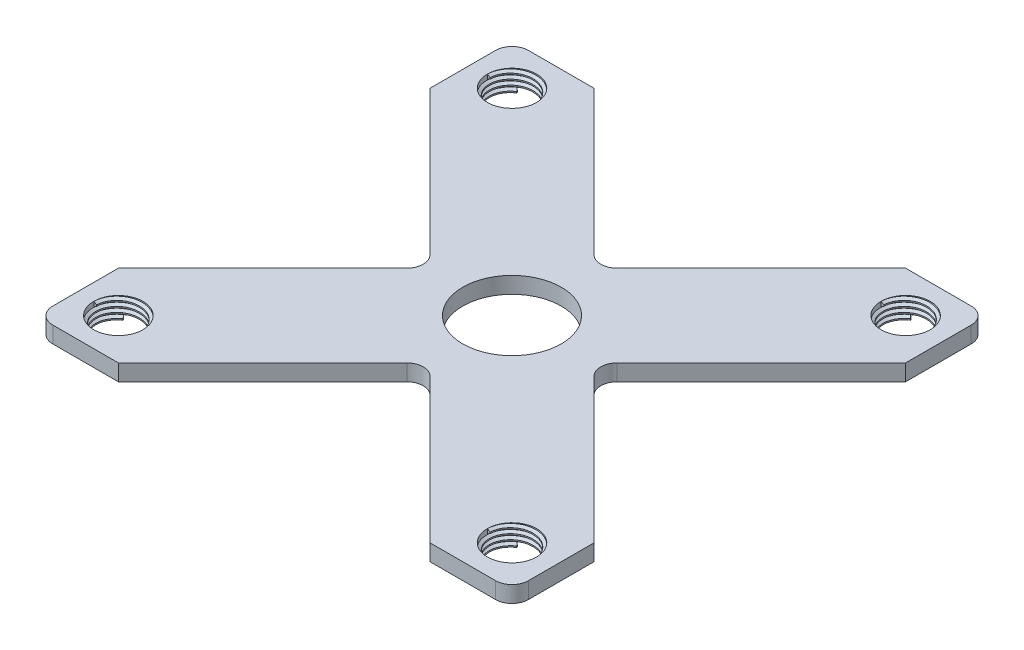
from build123d import *
from build123d.topology import SkipClean

# Parameters (mm, degrees)
SKETCH1_R           = 3
BOSS_EXTRUDE1_DEPTH = 1
FILLET1_R           = 1
SKETCH2_R           = 1.5
CUT_EXTRUDE1_DEPTH  = 10
THREAD1_PITCH       = 0.3175
THREAD2_PITCH       = 0.3175
THREAD3_PITCH       = 0.3175
THREAD4_PITCH       = 0.3175


with BuildPart() as part:
    # Sketch1 → Boss-Extrude1 (new body)
    with BuildSketch(Plane(origin=(0, 0, 0), x_dir=(1, 0, 0), z_dir=(0, 1, 0))):
        Polygon((0, 0), (9.5, 9.5), (19, 0), (24, 0), (24, 5), (14.5, 14.5), (24, 24), (24, 29), (19, 29), (9.5, 19.5), (0, 29), (-5, 29), (-5, 24), (4.5, 14.5), (-5, 5), (-5, 0), align=None)
        with Locations(Location((9.5, 14.5, 0), (0, 0, 270))):
            Circle(SKETCH1_R, mode=Mode.SUBTRACT)
    extrude(amount=BOSS_EXTRUDE1_DEPTH)

    # Fillet1
    fillet1_edges = [part.edges().sort_by_distance(p)[0] for p in [
        (-5, 0.5, 0),
        (4.5, 0.5, -14.5),
        (-5, 0.5, -29),
        (9.5, 0.5, -19.5),
        (24, 0.5, -29),
        (14.5, 0.5, -14.5),
        (24, 0.5, 0),
        (9.5, 0.5, -9.5),
    ]]
    fillet(fillet1_edges, radius=FILLET1_R)

    # Sketch2 → Cut-Extrude1 (cut)
    with BuildSketch(Plane(origin=(0, 1, 0), x_dir=(1, 0, 0), z_dir=(0, 1, 0))):
        with Locations(Location((21.5, 26.5, 0), (0, 0, 270))):
            Circle(SKETCH2_R)
        with Locations(Location((-2.5, 26.5, 0), (0, 0, 270))):
            Circle(SKETCH2_R)
        with Locations(Location((-2.5, 2.5, 0), (0, 0, 270))):
            Circle(SKETCH2_R)
        with Locations(Location((21.5, 2.5, 0), (0, 0, 270))):
            Circle(SKETCH2_R)
    extrude(amount=-CUT_EXTRUDE1_DEPTH, mode=Mode.SUBTRACT)

    # Thread1: the profile of Thread Profile1 profile screwed along a right-hand helix of 3.149606 turns, 6 arcs to a turn; built about Z, then put on its axis
    with SkipClean():  # the faces are left unmerged after this step: merging them gives an invalid solid
        thread1_z = Axis((0, 0, 0), (0, 0, 1))
        thread1_corners = [(1.5003, 0, -0.000173205), (1.5003, 0, 0.277985704), (1.328148085, 0, 0.17859375), (1.328148085, 0, 0.09921875)]
        with BuildLine(mode=Mode.PRIVATE) as thread1_profile:
            Line(thread1_corners[0], thread1_corners[1])
            Line(thread1_corners[1], thread1_corners[2])
            Line(thread1_corners[2], thread1_corners[3])
            Line(thread1_corners[3], thread1_corners[0])
        thread1_cap = Face(thread1_profile.wire())
        thread1_turn_angles = [0, 30, 60, 90, 120, 150, 180, 210, 240, 270, 300, 330, 360]
        thread1_turn_weights = [1, 0.8660254037844387, 1, 0.8660254037844387, 1, 0.8660254037844387, 1, 0.8660254037844387, 1, 0.8660254037844387, 1, 0.8660254037844387, 1]
        thread1_turn_rails = [Edge.make_bspline([Vector(p[0], p[1], 0).rotate(thread1_z, thread1_turn_angles[k]) / thread1_turn_weights[k] + Vector(0, 0, p[2] + THREAD1_PITCH * thread1_turn_angles[k] / 360) for k in range(13)], [0, 0, 0, 1, 1, 2, 2, 3, 3, 4, 4, 5, 5, 6, 6, 6], 2, thread1_turn_weights) for p in thread1_corners]
        thread1_turn_sides = [Face.make_surface_from_curves(thread1_turn_rails[p[0]], thread1_turn_rails[p[1]]) for p in [(0, 1), (1, 2), (2, 3), (3, 0)]]
        thread1_last_angles = [1080, 1106.929133858, 1133.858267717]
        thread1_last_weights = [1, 0.8915673595333442, 1]
        thread1_last_rails = [Edge.make_bspline([Vector(p[0], p[1], 0).rotate(thread1_z, thread1_last_angles[k]) / thread1_last_weights[k] + Vector(0, 0, p[2] + THREAD1_PITCH * thread1_last_angles[k] / 360) for k in range(3)], [0, 0, 0, 1, 1, 1], 2, thread1_last_weights) for p in thread1_corners]
        thread1_last_sides = [Face.make_surface_from_curves(thread1_last_rails[p[0]], thread1_last_rails[p[1]]) for p in [(0, 1), (1, 2), (2, 3), (3, 0)]]
        thread1 = Plane(origin=(-2.5, 1, -26.5), x_dir=(-1, 0, 0), z_dir=(0, -1, 0)) * Solid(Shell([*[p.moved(Location((0, 0, THREAD1_PITCH * i))) for i in range(3) for p in thread1_turn_sides], *thread1_last_sides, thread1_cap, thread1_cap.rotate(thread1_z, 1133.858267717).moved(Location((0, 0, THREAD1_PITCH * 1133.858267717 / 360)))]))
        add(thread1)

    # Thread2: the profile of Thread Profile2 profile screwed along a right-hand helix of 3.149606 turns, 6 arcs to a turn; built about Z, then put on its axis
    with SkipClean():  # the faces are left unmerged after this step: merging them gives an invalid solid
        thread2_z = Axis((0, 0, 0), (0, 0, 1))
        thread2_corners = [(1.5003, 0, -0.000173205), (1.5003, 0, 0.277985704), (1.328148085, 0, 0.17859375), (1.328148085, 0, 0.09921875)]
        with BuildLine(mode=Mode.PRIVATE) as thread2_profile:
            Line(thread2_corners[0], thread2_corners[1])
            Line(thread2_corners[1], thread2_corners[2])
            Line(thread2_corners[2], thread2_corners[3])
            Line(thread2_corners[3], thread2_corners[0])
        thread2_cap = Face(thread2_profile.wire())
        thread2_turn_angles = [0, 30, 60, 90, 120, 150, 180, 210, 240, 270, 300, 330, 360]
        thread2_turn_weights = [1, 0.8660254037844387, 1, 0.8660254037844387, 1, 0.8660254037844387, 1, 0.8660254037844387, 1, 0.8660254037844387, 1, 0.8660254037844387, 1]
        thread2_turn_rails = [Edge.make_bspline([Vector(p[0], p[1], 0).rotate(thread2_z, thread2_turn_angles[k]) / thread2_turn_weights[k] + Vector(0, 0, p[2] + THREAD2_PITCH * thread2_turn_angles[k] / 360) for k in range(13)], [0, 0, 0, 1, 1, 2, 2, 3, 3, 4, 4, 5, 5, 6, 6, 6], 2, thread2_turn_weights) for p in thread2_corners]
        thread2_turn_sides = [Face.make_surface_from_curves(thread2_turn_rails[p[0]], thread2_turn_rails[p[1]]) for p in [(0, 1), (1, 2), (2, 3), (3, 0)]]
        thread2_last_angles = [1080, 1106.929133858, 1133.858267717]
        thread2_last_weights = [1, 0.8915673595333442, 1]
        thread2_last_rails = [Edge.make_bspline([Vector(p[0], p[1], 0).rotate(thread2_z, thread2_last_angles[k]) / thread2_last_weights[k] + Vector(0, 0, p[2] + THREAD2_PITCH * thread2_last_angles[k] / 360) for k in range(3)], [0, 0, 0, 1, 1, 1], 2, thread2_last_weights) for p in thread2_corners]
        thread2_last_sides = [Face.make_surface_from_curves(thread2_last_rails[p[0]], thread2_last_rails[p[1]]) for p in [(0, 1), (1, 2), (2, 3), (3, 0)]]
        thread2 = Plane(origin=(-2.5, 1, -2.5), x_dir=(-1, 0, 0), z_dir=(0, -1, 0)) * Solid(Shell([*[p.moved(Location((0, 0, THREAD2_PITCH * i))) for i in range(3) for p in thread2_turn_sides], *thread2_last_sides, thread2_cap, thread2_cap.rotate(thread2_z, 1133.858267717).moved(Location((0, 0, THREAD2_PITCH * 1133.858267717 / 360)))]))
        add(thread2)

    # Thread3: the profile of Thread Profile3 profile screwed along a right-hand helix of 3.149606 turns, 6 arcs to a turn; built about Z, then put on its axis
    with SkipClean():  # the faces are left unmerged after this step: merging them gives an invalid solid
        thread3_z = Axis((0, 0, 0), (0, 0, 1))
        thread3_corners = [(1.5003, 0, -0.000173205), (1.5003, 0, 0.277985704), (1.328148085, 0, 0.17859375), (1.328148085, 0, 0.09921875)]
        with BuildLine(mode=Mode.PRIVATE) as thread3_profile:
            Line(thread3_corners[0], thread3_corners[1])
            Line(thread3_corners[1], thread3_corners[2])
            Line(thread3_corners[2], thread3_corners[3])
            Line(thread3_corners[3], thread3_corners[0])
        thread3_cap = Face(thread3_profile.wire())
        thread3_turn_angles = [0, 30, 60, 90, 120, 150, 180, 210, 240, 270, 300, 330, 360]
        thread3_turn_weights = [1, 0.8660254037844387, 1, 0.8660254037844387, 1, 0.8660254037844387, 1, 0.8660254037844387, 1, 0.8660254037844387, 1, 0.8660254037844387, 1]
        thread3_turn_rails = [Edge.make_bspline([Vector(p[0], p[1], 0).rotate(thread3_z, thread3_turn_angles[k]) / thread3_turn_weights[k] + Vector(0, 0, p[2] + THREAD3_PITCH * thread3_turn_angles[k] / 360) for k in range(13)], [0, 0, 0, 1, 1, 2, 2, 3, 3, 4, 4, 5, 5, 6, 6, 6], 2, thread3_turn_weights) for p in thread3_corners]
        thread3_turn_sides = [Face.make_surface_from_curves(thread3_turn_rails[p[0]], thread3_turn_rails[p[1]]) for p in [(0, 1), (1, 2), (2, 3), (3, 0)]]
        thread3_last_angles = [1080, 1106.929133858, 1133.858267717]
        thread3_last_weights = [1, 0.8915673595333442, 1]
        thread3_last_rails = [Edge.make_bspline([Vector(p[0], p[1], 0).rotate(thread3_z, thread3_last_angles[k]) / thread3_last_weights[k] + Vector(0, 0, p[2] + THREAD3_PITCH * thread3_last_angles[k] / 360) for k in range(3)], [0, 0, 0, 1, 1, 1], 2, thread3_last_weights) for p in thread3_corners]
        thread3_last_sides = [Face.make_surface_from_curves(thread3_last_rails[p[0]], thread3_last_rails[p[1]]) for p in [(0, 1), (1, 2), (2, 3), (3, 0)]]
        thread3 = Plane(origin=(21.5, 1, -2.5), x_dir=(-1, 0, 0), z_dir=(0, -1, 0)) * Solid(Shell([*[p.moved(Location((0, 0, THREAD3_PITCH * i))) for i in range(3) for p in thread3_turn_sides], *thread3_last_sides, thread3_cap, thread3_cap.rotate(thread3_z, 1133.858267717).moved(Location((0, 0, THREAD3_PITCH * 1133.858267717 / 360)))]))
        add(thread3)

    # Thread4: the profile of Thread Profile4 profile screwed along a right-hand helix of 3.149606 turns, 6 arcs to a turn; built about Z, then put on its axis
    with SkipClean():  # the faces are left unmerged after this step: merging them gives an invalid solid
        thread4_z = Axis((0, 0, 0), (0, 0, 1))
        thread4_corners = [(1.5003, 0, -0.000173205), (1.5003, 0, 0.277985704), (1.328148085, 0, 0.17859375), (1.328148085, 0, 0.09921875)]
        with BuildLine(mode=Mode.PRIVATE) as thread4_profile:
            Line(thread4_corners[0], thread4_corners[1])
            Line(thread4_corners[1], thread4_corners[2])
            Line(thread4_corners[2], thread4_corners[3])
            Line(thread4_corners[3], thread4_corners[0])
        thread4_cap = Face(thread4_profile.wire())
        thread4_turn_angles = [0, 30, 60, 90, 120, 150, 180, 210, 240, 270, 300, 330, 360]
        thread4_turn_weights = [1, 0.8660254037844387, 1, 0.8660254037844387, 1, 0.8660254037844387, 1, 0.8660254037844387, 1, 0.8660254037844387, 1, 0.8660254037844387, 1]
        thread4_turn_rails = [Edge.make_bspline([Vector(p[0], p[1], 0).rotate(thread4_z, thread4_turn_angles[k]) / thread4_turn_weights[k] + Vector(0, 0, p[2] + THREAD4_PITCH * thread4_turn_angles[k] / 360) for k in range(13)], [0, 0, 0, 1, 1, 2, 2, 3, 3, 4, 4, 5, 5, 6, 6, 6], 2, thread4_turn_weights) for p in thread4_corners]
        thread4_turn_sides = [Face.make_surface_from_curves(thread4_turn_rails[p[0]], thread4_turn_rails[p[1]]) for p in [(0, 1), (1, 2), (2, 3), (3, 0)]]
        thread4_last_angles = [1080, 1106.929133858, 1133.858267717]
        thread4_last_weights = [1, 0.8915673595333442, 1]
        thread4_last_rails = [Edge.make_bspline([Vector(p[0], p[1], 0).rotate(thread4_z, thread4_last_angles[k]) / thread4_last_weights[k] + Vector(0, 0, p[2] + THREAD4_PITCH * thread4_last_angles[k] / 360) for k in range(3)], [0, 0, 0, 1, 1, 1], 2, thread4_last_weights) for p in thread4_corners]
        thread4_last_sides = [Face.make_surface_from_curves(thread4_last_rails[p[0]], thread4_last_rails[p[1]]) for p in [(0, 1), (1, 2), (2, 3), (3, 0)]]
        thread4 = Plane(origin=(21.5, 1, -26.5), x_dir=(-1, 0, 0), z_dir=(0, -1, 0)) * Solid(Shell([*[p.moved(Location((0, 0, THREAD4_PITCH * i))) for i in range(3) for p in thread4_turn_sides], *thread4_last_sides, thread4_cap, thread4_cap.rotate(thread4_z, 1133.858267717).moved(Location((0, 0, THREAD4_PITCH * 1133.858267717 / 360)))]))
        add(thread4)


solid = part.part
